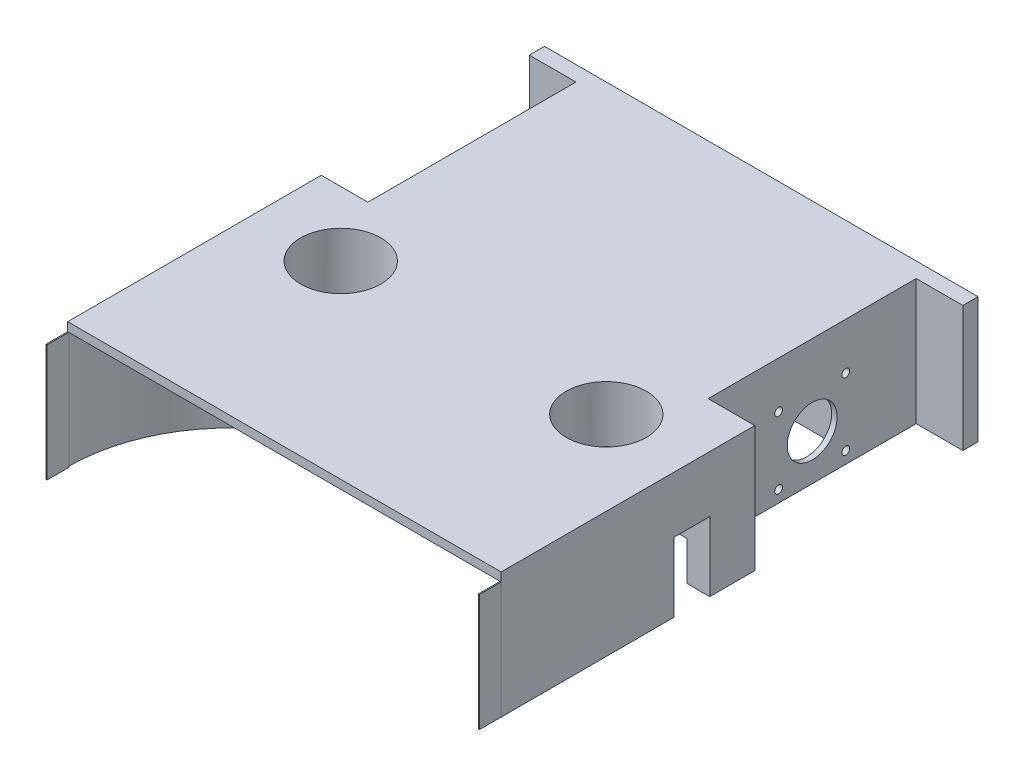
from build123d import *

# Parameters (mm, degrees)
SKETCH_1_W              = 200
SKETCH_1_H              = 220
EXTRUDE_1_DEPTH         = 4
EXTRUDE_2_DEPTH         = 54
SKETCH_1_5_W            = 0.5
SKETCH_1_5_H            = 10
EXTRUDE_3_DEPTH         = 54
EXTRUDE_3_2_DEPTH       = 54
CUT_EXTRUDE_2_DEPTH     = 303.925733473
CUT_EXTRUDE_3_DEPTH     = 42
SKETCH_7_R              = 1.8
SKETCH_7_R_2            = 11.5
CUT_EXTRUDE_4_DEPTH     = 287.865822293
MIRROR_START            = 176
MIRROR_1_OUTLINE_R      = 1.8
MIRROR_1_OUTLINE_R_2    = 11.5
MIRROR_1_DEPTH          = 2.5
CUT_EXTRUDE_START       = -21
CUT_EXTRUDE_5_OUTLINE_W = 34
CUT_EXTRUDE_5_OUTLINE_H = 16
CUT_EXTRUDE_5_DEPTH     = 21
CUT_EXTRUDE_START_2     = -6
CUT_EXTRUDE_6_OUTLINE_W = 34
CUT_EXTRUDE_6_OUTLINE_H = 24
CUT_EXTRUDE_6_DEPTH     = 6
SKETCH_11_R             = 34
CUT_EXTRUDE_7_DEPTH     = 18
CUT_EXTRUDE_8_DEPTH     = 32
SKETCH_15_R             = 18.5
CUT_EXTRUDE_11_DEPTH    = 26
SKETCH_17_R             = 1.5
CUT_EXTRUDE_14_DEPTH    = 301


# Read off the part's stored shape, not the designer's step: 镜向1, 切除-拉伸5, 切除-拉伸6
with BuildPart() as part:
    # 草图1 → 凸台-拉伸1 (new body)
    with BuildSketch(Plane(origin=(0, 0, 0), x_dir=(1, 0, 0), z_dir=(0, 1, 0))):
        with Locations((100, 110)):
            Rectangle(SKETCH_1_W, SKETCH_1_H)
    extrude(amount=EXTRUDE_1_DEPTH)

    # 草图1<4> → 凸台-拉伸2 (add)
    with BuildSketch(Plane(origin=(0, 0, 0), x_dir=(1, 0, 0), z_dir=(0, 1, 0))):
        with BuildLine():
            Line((0, 220), (0, 0))
            ThreePointArc((0, 0), (21.966991411, 53.033008589), (75, 75))
            Line((75, 75), (75, 220))
            Line((75, 220), (0, 220))
        make_face()
        with BuildLine():
            Line((125, 220), (125, 75))
            ThreePointArc((125, 75), (178.033008589, 53.033008589), (200, 0))
            Line((200, 0), (200, 220))
            Line((200, 220), (125, 220))
        make_face()
    extrude(amount=-EXTRUDE_2_DEPTH)

    # 草图3 → 切除-拉伸2 (cut, through all)
    with BuildSketch(Plane.XZ.offset(54)):
        Polygon((21.5, -186), (21.5, -165), (21.5, -144), (21.5, -117), (0, -117), (0, -213), (21.5, -213), align=None)
        Polygon((178.5, -117), (200, -117), (200, -213), (178.5, -213), (178.5, -165), align=None)
    extrude(amount=-CUT_EXTRUDE_2_DEPTH, mode=Mode.SUBTRACT)

    # 草图5 → 切除-拉伸3 (cut)
    with BuildSketch(Plane.XZ.offset(54)):
        Polygon((176, -165), (176, -144), (125, -144), (125, -186), (176, -186), align=None)
        Polygon((24, -165), (24, -144), (75, -144), (75, -186), (24, -186), align=None)
    extrude(amount=-CUT_EXTRUDE_3_DEPTH, mode=Mode.SUBTRACT)

    # 草图7 → 切除-拉伸4 (cut, through all)
    with BuildSketch(Plane(origin=(24, 0, 0), x_dir=(0, 0, -1), z_dir=(1, 0, 0))):
        with Locations((180.5, -17.5)):
            Circle(SKETCH_7_R)
        with Locations((149.5, -17.5)):
            Circle(SKETCH_7_R)
        with Locations((165, -33)):
            Circle(SKETCH_7_R_2)
        with Locations((180.5, -48.5)):
            Circle(SKETCH_7_R)
        with Locations((149.5, -48.5)):
            Circle(SKETCH_7_R)
    extrude(amount=-CUT_EXTRUDE_4_DEPTH, mode=Mode.SUBTRACT)

    # 镜向1 outline → 镜向1 (cut)
    with BuildSketch(Plane.YZ.offset(MIRROR_START)):
        with Locations((-17.5, -180.5)):
            Circle(MIRROR_1_OUTLINE_R)
        with Locations((-17.5, -149.5)):
            Circle(MIRROR_1_OUTLINE_R)
        with Locations((-33, -165)):
            Circle(MIRROR_1_OUTLINE_R_2)
        with Locations((-48.5, -180.5)):
            Circle(MIRROR_1_OUTLINE_R)
        with Locations((-48.5, -149.5)):
            Circle(MIRROR_1_OUTLINE_R)
    extrude(amount=MIRROR_1_DEPTH, mode=Mode.SUBTRACT)

    # 切除-拉伸5 outline → 切除-拉伸5 (cut)
    with BuildSketch(Plane(origin=(75, 0, 0), x_dir=(0, 0, -1), z_dir=(1, 0, 0)).offset(CUT_EXTRUDE_START)):
        with Locations((203, -33)):
            Rectangle(CUT_EXTRUDE_5_OUTLINE_W, CUT_EXTRUDE_5_OUTLINE_H)
    extrude(amount=CUT_EXTRUDE_5_DEPTH, mode=Mode.SUBTRACT)

    # 切除-拉伸6 outline → 切除-拉伸6 (cut)
    with BuildSketch(Plane.ZY.offset(-125).offset(CUT_EXTRUDE_START_2)):
        with Locations((-203, -33)):
            Rectangle(CUT_EXTRUDE_6_OUTLINE_W, CUT_EXTRUDE_6_OUTLINE_H)
    extrude(amount=CUT_EXTRUDE_6_DEPTH, mode=Mode.SUBTRACT)

    # 草图11 → 切除-拉伸7 (cut)
    with BuildSketch(Plane.XZ.offset(54)):
        with Locations((43.588095895, -88.0112367)):
            Circle(SKETCH_11_R)
        with Locations((156.411904105, -88.0112367)):
            Circle(SKETCH_11_R)
    extrude(amount=-CUT_EXTRUDE_7_DEPTH, mode=Mode.SUBTRACT)

    # 草图12 → 切除-拉伸8 (cut)
    with BuildSketch(Plane.XZ.offset(54)):
        with BuildLine():
            Line((43.588095895, -79.776603565), (0, -79.776603565))
            Line((0, -79.776603565), (0, -96.245869836))
            Line((0, -96.245869836), (43.588095895, -96.245869836))
            ThreePointArc((43.588095895, -96.245869836), (51.82272903, -88.0112367), (43.588095895, -79.776603565))
        make_face()
        with BuildLine():
            Line((200, -79.776603565), (200, -96.245869836))
            Line((200, -96.245869836), (156.411904105, -96.245869836))
            ThreePointArc((156.411904105, -96.245869836), (148.17727097, -88.0112367), (156.411904105, -79.776603565))
            Line((156.411904105, -79.776603565), (200, -79.776603565))
        make_face()
    extrude(amount=-CUT_EXTRUDE_8_DEPTH, mode=Mode.SUBTRACT)

    # 草图15 → 切除-拉伸11 (cut)
    with BuildSketch(Plane(origin=(0, 4, 0), x_dir=(1, 0, 0), z_dir=(0, 1, 0))):
        with Locations(Location((38.73585496, 87.245869836, 0), (0, 0, 270))):
            Circle(SKETCH_15_R)
        with Locations(Location((161.26414504, 87.245869836, 0), (0, 0, 336.187548677))):
            Circle(SKETCH_15_R)
    extrude(amount=-CUT_EXTRUDE_11_DEPTH, mode=Mode.SUBTRACT)

    # 草图17 → 切除-拉伸14 (cut, through all)
    with BuildSketch(Plane.XZ.offset(36)):
        with Locations((25.312461201, -79.495869836)):
            Circle(SKETCH_17_R)
        with Locations(Location((38.73585496, -71.745869836, 0), (0, 0, 270))):
            Circle(SKETCH_17_R)
        with Locations(Location((52.159248718, -79.495869836, 0), (0, 0, 270))):
            Circle(SKETCH_17_R)
        with Locations(Location((52.159248718, -94.995869836, 0), (0, 0, 270))):
            Circle(SKETCH_17_R)
        with Locations(Location((38.73585496, -102.745869836, 0), (0, 0, 270))):
            Circle(SKETCH_17_R)
        with Locations((25.312461201, -94.995869836)):
            Circle(SKETCH_17_R)
        with Locations((174.687538799, -94.995869836)):
            Circle(SKETCH_17_R)
        with Locations(Location((161.26414504, -102.745869836, 0), (0, 0, 270))):
            Circle(SKETCH_17_R)
        with Locations(Location((147.840751282, -94.995869836, 0), (0, 0, 270))):
            Circle(SKETCH_17_R)
        with Locations(Location((147.840751282, -79.495869836, 0), (0, 0, 270))):
            Circle(SKETCH_17_R)
        with Locations(Location((161.26414504, -71.745869836, 0), (0, 0, 270))):
            Circle(SKETCH_17_R)
        with Locations((174.687538799, -79.495869836)):
            Circle(SKETCH_17_R)
    extrude(amount=-CUT_EXTRUDE_14_DEPTH, mode=Mode.SUBTRACT)


with BuildPart() as body_2:
    # 草图1<5> → 凸台-拉伸3 (new body)
    with BuildSketch(Plane(origin=(0, 0, 0), x_dir=(1, 0, 0), z_dir=(0, 1, 0))):
        with Locations((199.75, -5)):
            Rectangle(SKETCH_1_5_W, SKETCH_1_5_H)
    extrude(amount=-EXTRUDE_3_DEPTH)


with BuildPart() as body_3:
    # 草图1<5> → Extrude 3 2 (new body)
    with BuildSketch(Plane(origin=(0, 0, 0), x_dir=(1, 0, 0), z_dir=(0, 1, 0))):
        with Locations((0.25, -5)):
            Rectangle(SKETCH_1_5_W, SKETCH_1_5_H)
    extrude(amount=-EXTRUDE_3_2_DEPTH)


solid = Compound([part.part, body_2.part, body_3.part])
